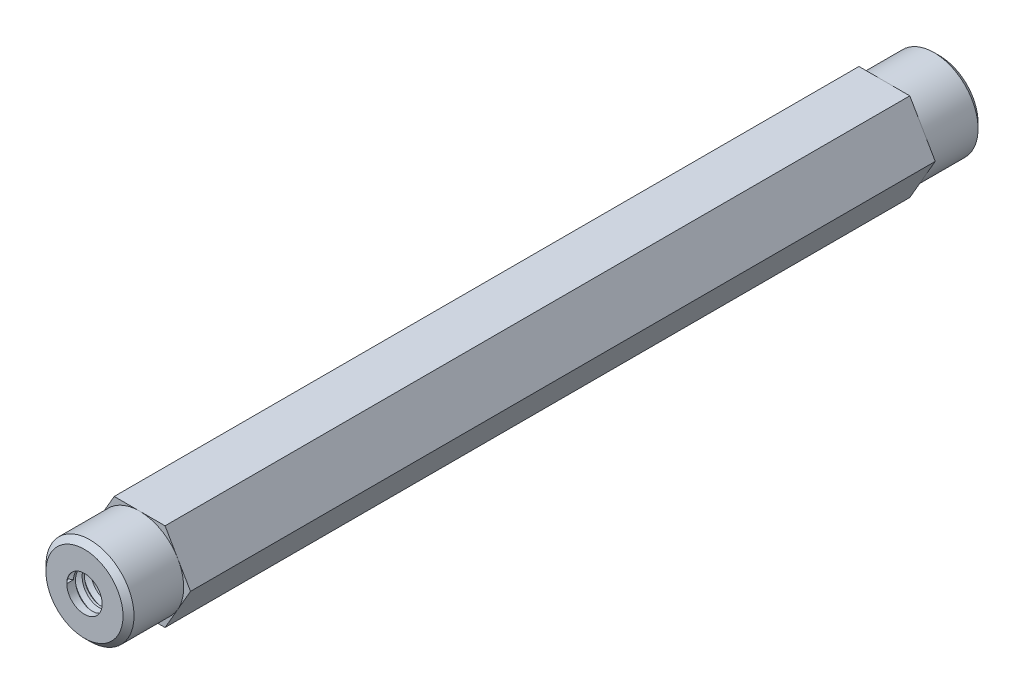
from build123d import *
from build123d.topology import SkipClean

# Parameters (mm, degrees)
EXTRUSI_N_HEX_PROFILE_DEPTH = 61.628150048
TAP_START                   = 61.62815
CROQUIS3_R                  = 2.5527
TAP_HOLE_1_DEPTH            = 19.05
TAP_START_2                 = -42.57815
CROQUIS3_3_R                = 2.5527
TAP_HOLE_2_DEPTH            = 19.05
ROSCA1_PITCH                = 1.27
ROSCA2_PITCH                = 1.27


with BuildPart() as part:
    # Croquis2 → Extrusión Hex Profile (new, symmetric)
    with BuildSketch(Plane.XY):
        Polygon((3.666174209, -6.35), (7.332348419, 0), (3.666174209, 6.35), (-3.666174209, 6.35), (-7.332348419, 0), (-3.666174209, -6.35), align=None)
    extrude(amount=EXTRUSI_N_HEX_PROFILE_DEPTH, both=True)

    # Croquis3 → Tap Hole 1 (cut)
    with BuildSketch(Plane.XY.offset(TAP_START)):
        Circle(CROQUIS3_R)
    extrude(amount=-TAP_HOLE_1_DEPTH, mode=Mode.SUBTRACT)

    # Croquis3<3> → Tap Hole 2 (cut)
    with BuildSketch(Plane.XY.offset(TAP_START_2)):
        Circle(CROQUIS3_3_R)
    extrude(amount=-TAP_HOLE_2_DEPTH, mode=Mode.SUBTRACT)

    # Croquis10 → Round End 1 (revolve, cut)
    with BuildSketch(Plane(origin=(0, 0, 0), x_dir=(1, 0, 0), z_dir=(0, 1, 0)), mode=Mode.PRIVATE) as round_end_1_sk:
        Polygon((-5.55625, -61.628150048), (-6.35, -60.834400048), (-6.35, -53.677950048), (-9.525, -53.677950048), (-9.525, -61.628150048), align=None)
    revolve(round_end_1_sk.sketch.rotate(Axis((0, 0, 61.628150048), (0, 0, -1)), 180), axis=Axis((0, 0, 61.628150048), (0, 0, -1)), mode=Mode.SUBTRACT)

    # Croquis12 → Round End 2 (revolve, cut)
    with BuildSketch(Plane.XZ):
        Polygon((-5.55625, -61.628150048), (-6.35, -60.834400048), (-6.35, -53.677950048), (-9.525, -53.677950048), (-9.525, -61.628150048), align=None)
    revolve(axis=Axis((0, 0, -61.628150048), (0, 0, 1)), mode=Mode.SUBTRACT)

    # Rosca1: the profile of Perfil de rosca1 profile screwed along a right-hand helix of 15 turns, 8 arcs to a turn; built about Z, then put on its axis
    with SkipClean():  # the faces are left unmerged after this step: merging them gives an invalid solid
        rosca1_z = Axis((0, 0, 0), (0, 0, 1))
        rosca1_corners = [(2.5524, 0, -0.000173205), (3.240107661, 0, 0.396874998), (3.240107661, 0, 0.555624998), (2.5524, 0, 0.952673202)]
        with BuildLine(mode=Mode.PRIVATE) as rosca1_profile:
            Line(rosca1_corners[0], rosca1_corners[1])
            Line(rosca1_corners[1], rosca1_corners[2])
            Line(rosca1_corners[2], rosca1_corners[3])
            Line(rosca1_corners[3], rosca1_corners[0])
        rosca1_cap = Face(rosca1_profile.wire())
        rosca1_turn_angles = [0, 22.5, 45, 67.5, 90, 112.5, 135, 157.5, 180, 202.5, 225, 247.5, 270, 292.5, 315, 337.5, 360]
        rosca1_turn_weights = [1, 0.9238795325112867, 1, 0.9238795325112867, 1, 0.9238795325112867, 1, 0.9238795325112867, 1, 0.9238795325112867, 1, 0.9238795325112867, 1, 0.9238795325112867, 1, 0.9238795325112867, 1]
        rosca1_turn_rails = [Edge.make_bspline([Vector(p[0], p[1], 0).rotate(rosca1_z, rosca1_turn_angles[k]) / rosca1_turn_weights[k] + Vector(0, 0, p[2] + ROSCA1_PITCH * rosca1_turn_angles[k] / 360) for k in range(17)], [0, 0, 0, 1, 1, 2, 2, 3, 3, 4, 4, 5, 5, 6, 6, 7, 7, 8, 8, 8], 2, rosca1_turn_weights) for p in rosca1_corners]
        rosca1_turn_sides = [Face.make_surface_from_curves(rosca1_turn_rails[p[0]], rosca1_turn_rails[p[1]]) for p in [(0, 1), (1, 2), (2, 3), (3, 0)]]
        rosca1 = Plane(origin=(0, 0, 61.628150048), x_dir=(-1, 0, 0), z_dir=(0, 0, -1)) * Solid(Shell([*[p.moved(Location((0, 0, ROSCA1_PITCH * i))) for i in range(15) for p in rosca1_turn_sides], rosca1_cap, rosca1_cap.rotate(rosca1_z, 5400).moved(Location((0, 0, ROSCA1_PITCH * 5400 / 360)))]))
        add(rosca1, mode=Mode.SUBTRACT)

    # Rosca2: the profile of Perfil de rosca2 profile screwed along a right-hand helix of 15 turns, 8 arcs to a turn; built about Z, then put on its axis
    with SkipClean():  # the faces are left unmerged after this step: merging them gives an invalid solid
        rosca2_z = Axis((0, 0, 0), (0, 0, 1))
        rosca2_corners = [(2.5524, 0, -0.000173205), (3.240107661, 0, 0.396874998), (3.240107661, 0, 0.555624998), (2.5524, 0, 0.952673202)]
        with BuildLine(mode=Mode.PRIVATE) as rosca2_profile:
            Line(rosca2_corners[0], rosca2_corners[1])
            Line(rosca2_corners[1], rosca2_corners[2])
            Line(rosca2_corners[2], rosca2_corners[3])
            Line(rosca2_corners[3], rosca2_corners[0])
        rosca2_cap = Face(rosca2_profile.wire())
        rosca2_turn_angles = [0, 22.5, 45, 67.5, 90, 112.5, 135, 157.5, 180, 202.5, 225, 247.5, 270, 292.5, 315, 337.5, 360]
        rosca2_turn_weights = [1, 0.9238795325112867, 1, 0.9238795325112867, 1, 0.9238795325112867, 1, 0.9238795325112867, 1, 0.9238795325112867, 1, 0.9238795325112867, 1, 0.9238795325112867, 1, 0.9238795325112867, 1]
        rosca2_turn_rails = [Edge.make_bspline([Vector(p[0], p[1], 0).rotate(rosca2_z, rosca2_turn_angles[k]) / rosca2_turn_weights[k] + Vector(0, 0, p[2] + ROSCA2_PITCH * rosca2_turn_angles[k] / 360) for k in range(17)], [0, 0, 0, 1, 1, 2, 2, 3, 3, 4, 4, 5, 5, 6, 6, 7, 7, 8, 8, 8], 2, rosca2_turn_weights) for p in rosca2_corners]
        rosca2_turn_sides = [Face.make_surface_from_curves(rosca2_turn_rails[p[0]], rosca2_turn_rails[p[1]]) for p in [(0, 1), (1, 2), (2, 3), (3, 0)]]
        rosca2 = Plane(origin=(0, 0, -61.628150048), x_dir=(1, 0, 0), z_dir=(0, 0, 1)) * Solid(Shell([*[p.moved(Location((0, 0, ROSCA2_PITCH * i))) for i in range(15) for p in rosca2_turn_sides], rosca2_cap, rosca2_cap.rotate(rosca2_z, 5400).moved(Location((0, 0, ROSCA2_PITCH * 5400 / 360)))]))
        add(rosca2, mode=Mode.SUBTRACT)


solid = part.part
